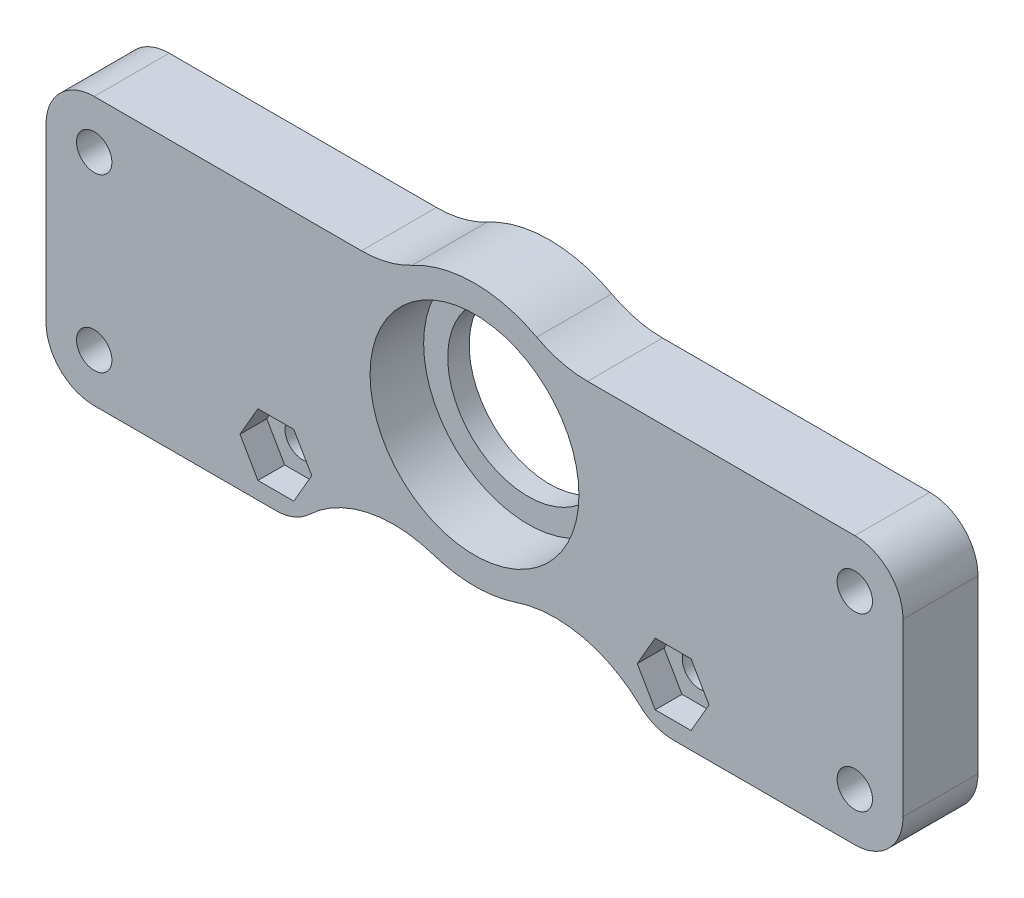
from build123d import *

# Parameters (mm, degrees)
SKETCH1_R           = 9.75
SKETCH1_R_2         = 1.65
BOSS_EXTRUDE1_DEPTH = 7
FILLET1_R           = 10
SKETCH2_R           = 9.75
SKETCH2_R_2         = 7.5
BOSS_EXTRUDE2_DEPTH = 2
CUT_EXTRUDE1_DEPTH  = 2.5
BOSS_EXTRUDE3_START = 1.5
SKETCH4_R           = 2.5
SKETCH4_R_2         = 1.65
BOSS_EXTRUDE3_DEPTH = 1.5
SKETCH5_R           = 2.95
CUT_EXTRUDE2_DEPTH  = 3.2


with BuildPart() as part:
    # Sketch1 → Boss-Extrude1 (new body)
    with BuildSketch(Plane.XY):
        with BuildLine():
            Line((-35.5, 9.588593938), (-7.623737029, 9.588593938))
            ThreePointArc((-7.623737029, 9.588593938), (0, 12.25), (7.623737029, 9.588593938))
            Line((7.623737029, 9.588593938), (35.5, 9.588593938))
            ThreePointArc((35.5, 9.588593938), (38.681980515, 8.270574454), (40, 5.088593938))
            Line((40, 5.088593938), (40, -10.911406062))
            ThreePointArc((40, -10.911406062), (38.681980515, -14.093386577), (35.5, -15.411406062))
            Line((35.5, -15.411406062), (18.542115282, -15.411406062))
            ThreePointArc((18.542115282, -15.411406062), (16.87570332, -15.091486345), (15.44623271, -14.177215472))
            ThreePointArc((15.44623271, -14.177215472), (10.021005103, -11.295196388), (3.88623271, -11.617215472))
            ThreePointArc((3.88623271, -11.617215472), (0, -12.25), (-3.88623271, -11.617215472))
            ThreePointArc((-3.88623271, -11.617215472), (-10.021005103, -11.295196388), (-15.44623271, -14.177215472))
            ThreePointArc((-15.44623271, -14.177215472), (-16.87570332, -15.091486345), (-18.542115282, -15.411406062))
            Line((-18.542115282, -15.411406062), (-35.5, -15.411406062))
            ThreePointArc((-35.5, -15.411406062), (-38.681980515, -14.093386577), (-40, -10.911406062))
            Line((-40, -10.911406062), (-40, 5.088593938))
            ThreePointArc((-40, 5.088593938), (-38.681980515, 8.270574454), (-35.5, 9.588593938))
        make_face()
        Circle(SKETCH1_R, mode=Mode.SUBTRACT)
        with Locations((-35.5, 5.088593938)):
            Circle(SKETCH1_R_2, mode=Mode.SUBTRACT)
        with Locations((35.5, 5.088593938)):
            Circle(SKETCH1_R_2, mode=Mode.SUBTRACT)
        with Locations((-18.542115282, -10.911406062)):
            Circle(SKETCH1_R_2, mode=Mode.SUBTRACT)
        with Locations((-35.5, -10.911406062)):
            Circle(SKETCH1_R_2, mode=Mode.SUBTRACT)
        with Locations((18.542115282, -10.911406062)):
            Circle(SKETCH1_R_2, mode=Mode.SUBTRACT)
        with Locations((35.5, -10.911406062)):
            Circle(SKETCH1_R_2, mode=Mode.SUBTRACT)
    extrude(amount=BOSS_EXTRUDE1_DEPTH)

    # Fillet1
    fillet1_edges = [part.edges().sort_by_distance(p)[0] for p in [
        (7.623737029, 9.588593938, 3.5),
        (-7.623737029, 9.588593938, 3.5),
    ]]
    fillet(fillet1_edges, radius=FILLET1_R)

    # Sketch2 → Boss-Extrude2 (add)
    with BuildSketch(Plane.XY):
        Circle(SKETCH2_R)
        Circle(SKETCH2_R_2, mode=Mode.SUBTRACT)
    extrude(amount=BOSS_EXTRUDE2_DEPTH)

    # Sketch3 → Cut-Extrude1 (cut)
    with BuildSketch(Plane.XY.offset(7)):
        Polygon((-16.867799501, -8.011406062), (-20.216431062, -8.011406062), (-21.890746843, -10.911406062), (-20.216431062, -13.811406062), (-16.867799501, -13.811406062), (-15.19348372, -10.911406062), align=None)
        Polygon((20.216431062, -8.011406062), (16.867799501, -8.011406062), (15.19348372, -10.911406062), (16.867799501, -13.811406062), (20.216431062, -13.811406062), (21.890746843, -10.911406062), align=None)
    extrude(amount=-CUT_EXTRUDE1_DEPTH, mode=Mode.SUBTRACT)

    # Sketch4 → Boss-Extrude3 (add)
    # profile 1 of 2: a face of its own
    with BuildSketch(Plane(origin=(0, 0, 0), x_dir=(-1, 0, 0), z_dir=(0, 0, -1)).offset(BOSS_EXTRUDE3_START)):
        with Locations((-18.542115282, -10.911406062)):
            Circle(SKETCH4_R)
        with Locations((-18.542115282, -10.911406062)):
            Circle(SKETCH4_R_2, mode=Mode.SUBTRACT)
    # profile 2 of 2: a face of its own
    with BuildSketch(Plane(origin=(0, 0, 0), x_dir=(-1, 0, 0), z_dir=(0, 0, -1)).offset(BOSS_EXTRUDE3_START)):
        with Locations((18.542115282, -10.911406062)):
            Circle(SKETCH4_R)
        with Locations((18.542115282, -10.911406062)):
            Circle(SKETCH4_R_2, mode=Mode.SUBTRACT)
    extrude(amount=-BOSS_EXTRUDE3_DEPTH)

    # Sketch5 → Cut-Extrude2 (cut)
    with BuildSketch(Plane(origin=(0, 0, 0), x_dir=(-1, 0, 0), z_dir=(0, 0, -1))):
        with Locations((-35.5, 5.088593938)):
            Circle(SKETCH5_R)
        with Locations((-35.5, -10.911406062)):
            Circle(SKETCH5_R)
        with Locations((35.5, 5.088593938)):
            Circle(SKETCH5_R)
        with Locations((35.5, -10.911406062)):
            Circle(SKETCH5_R)
    extrude(amount=-CUT_EXTRUDE2_DEPTH, mode=Mode.SUBTRACT)


solid = part.part
